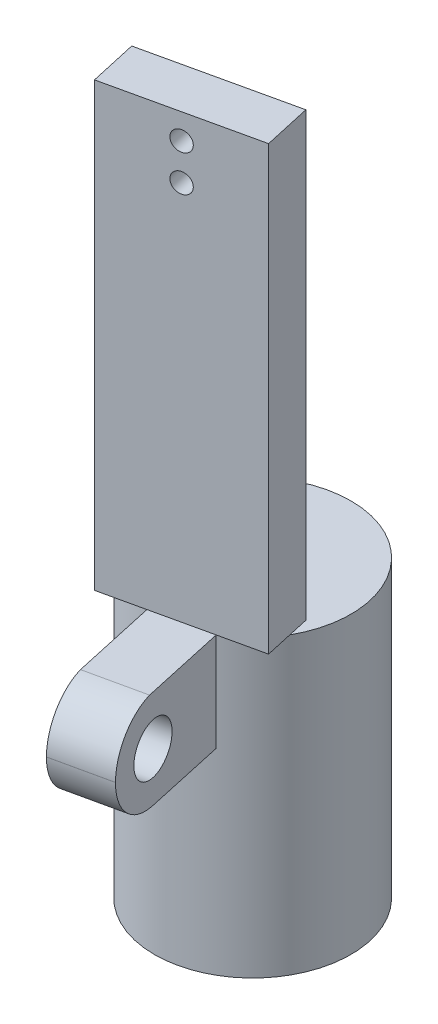
from build123d import *

# Parameters (mm, degrees)
SKETCH_2_R          = 10
EXTRUDE_1_DEPTH     = 30
EXTRUDE_START       = -10
EXTRUDE_2_DEPTH     = 10
CUT_EXTRUDE_4_DEPTH = 41.372064023
CUT_EXTRUDE_5_DEPTH = 41.372064023
CUT_EXTRUDE_6_DEPTH = 41.372064023
CUT_EXTRUDE_7_DEPTH = 41.372064023
SKETCH_10_R         = 5.05
CUT_EXTRUDE_8_DEPTH = 25
EXTRUDE_3_DEPTH     = 45
SKETCH_12_R         = 1
CUT_EXTRUDE_9_DEPTH = 79.386948681


with BuildPart() as part:
    # Эскиз2 → Бобышка-Вытянуть1 (new body)
    with BuildSketch(Plane(origin=(0, 0, 0), x_dir=(1, 0, 0), z_dir=(0, 1, 0))):
        Circle(SKETCH_2_R)
    extrude(amount=EXTRUDE_1_DEPTH)

    # Эскиз4 → Бобышка-Вытянуть2 (add)
    with BuildSketch(Plane(origin=(0, 30, 0), x_dir=(1, 0, 0), z_dir=(0, 1, 0)).offset(EXTRUDE_START)):
        with BuildLine():
            Line((7.857286278, -21.821134908), (4.965257474, -8.680219941))
            ThreePointArc((4.965257474, -8.680219941), (2.18360644, -9.758681413), (-0.792400015, -9.968555674))
            Line((-0.792400015, -9.968555674), (2.095178486, -23.089249172))
            Line((2.095178486, -23.089249172), (7.857286278, -21.821134908))
        make_face()
    extrude(amount=EXTRUDE_2_DEPTH)

    # Эскиз6 → Вырез-Вытянуть4 (cut, through all)
    with BuildSketch(Plane(origin=(2.913802079, 0, -0.641264293), x_dir=(-0.2149346210056599, 0, -0.9766284394247146), z_dir=(0.9766284394247146, 0, -0.2149346210056599))):
        with BuildLine():
            Line((-22.999943781, 25.008760147), (-22.999943781, 20))
            Line((-22.999943781, 20), (-18.179619595, 20))
            ThreePointArc((-18.179619595, 20), (-21.599118817, 21.533015498), (-22.999943781, 25.008760147))
        make_face()
    extrude(amount=-CUT_EXTRUDE_4_DEPTH, mode=Mode.SUBTRACT)

    # Эскиз6<3> → Вырез-Вытянуть5 (cut, through all)
    with BuildSketch(Plane(origin=(2.913802079, 0, -0.641264293), x_dir=(-0.2149346210056599, 0, -0.9766284394247146), z_dir=(0.9766284394247146, 0, -0.2149346210056599))):
        with BuildLine():
            Line((-22.999943781, 30), (-22.999943781, 25.008760147))
            ThreePointArc((-22.999943781, 25.008760147), (-21.691086809, 28.386338596), (-18.448057419, 30))
            Line((-18.448057419, 30), (-22.999943781, 30))
        make_face()
    extrude(amount=-CUT_EXTRUDE_5_DEPTH, mode=Mode.SUBTRACT)

    # Эскиз6<4> → Вырез-Вытянуть6 (cut, through all)
    with BuildSketch(Plane(origin=(2.913802079, 0, -0.641264293), x_dir=(-0.2149346210056599, 0, -0.9766284394247146), z_dir=(0.9766284394247146, 0, -0.2149346210056599))):
        with BuildLine():
            Line((-15.437501839, 25.006114345), (-20.537499094, 25.01140595))
            ThreePointArc((-20.537499094, 25.01140595), (-17.990146269, 22.45876152), (-15.437501839, 25.006114345))
        make_face()
    extrude(amount=-CUT_EXTRUDE_6_DEPTH, mode=Mode.SUBTRACT)

    # Эскиз6<5> → Вырез-Вытянуть7 (cut, through all)
    with BuildSketch(Plane(origin=(2.913802079, 0, -0.641264293), x_dir=(-0.2149346210056599, 0, -0.9766284394247146), z_dir=(0.9766284394247146, 0, -0.2149346210056599))):
        with BuildLine():
            ThreePointArc((-15.437500467, 25.008760147), (-17.986177565, 27.558759804), (-20.537499094, 25.01140595))
            Line((-20.537499094, 25.01140595), (-15.437501839, 25.006114345))
            ThreePointArc((-15.437501839, 25.006114345), (-15.43750081, 25.007437246), (-15.437500467, 25.008760147))
        make_face()
    extrude(amount=-CUT_EXTRUDE_7_DEPTH, mode=Mode.SUBTRACT)

    # Эскиз10 → Вырез-Вытянуть8 (cut)
    with BuildSketch(Plane.XZ):
        Circle(SKETCH_10_R)
    extrude(amount=-CUT_EXTRUDE_8_DEPTH, mode=Mode.SUBTRACT)

    # Эскиз11 → Бобышка-Вытянуть3 (add)
    with BuildSketch(Plane(origin=(0, 30, 0), x_dir=(1, 0, 0), z_dir=(0, 1, 0))):
        Polygon((-6.246428482, -6.065308226), (-5.154625262, -10.944648932), (9.327482721, -7.704126682), (8.235679501, -2.824785976), align=None)
    extrude(amount=EXTRUDE_3_DEPTH)

    # Эскиз12 → Вырез-Вытянуть9 (cut, through all)
    with BuildSketch(Plane(origin=(2.08642873, 0, 9.324387807), x_dir=(0.975868141278159, 0, -0.21836064397759777), z_dir=(0.21836064397759777, 0, 0.975868141278159))):
        with Locations((0, 72.426081563)):
            Circle(SKETCH_12_R)
        with Locations((0, 68.735454777)):
            Circle(SKETCH_12_R)
    extrude(amount=-CUT_EXTRUDE_9_DEPTH, mode=Mode.SUBTRACT)


solid = part.part
